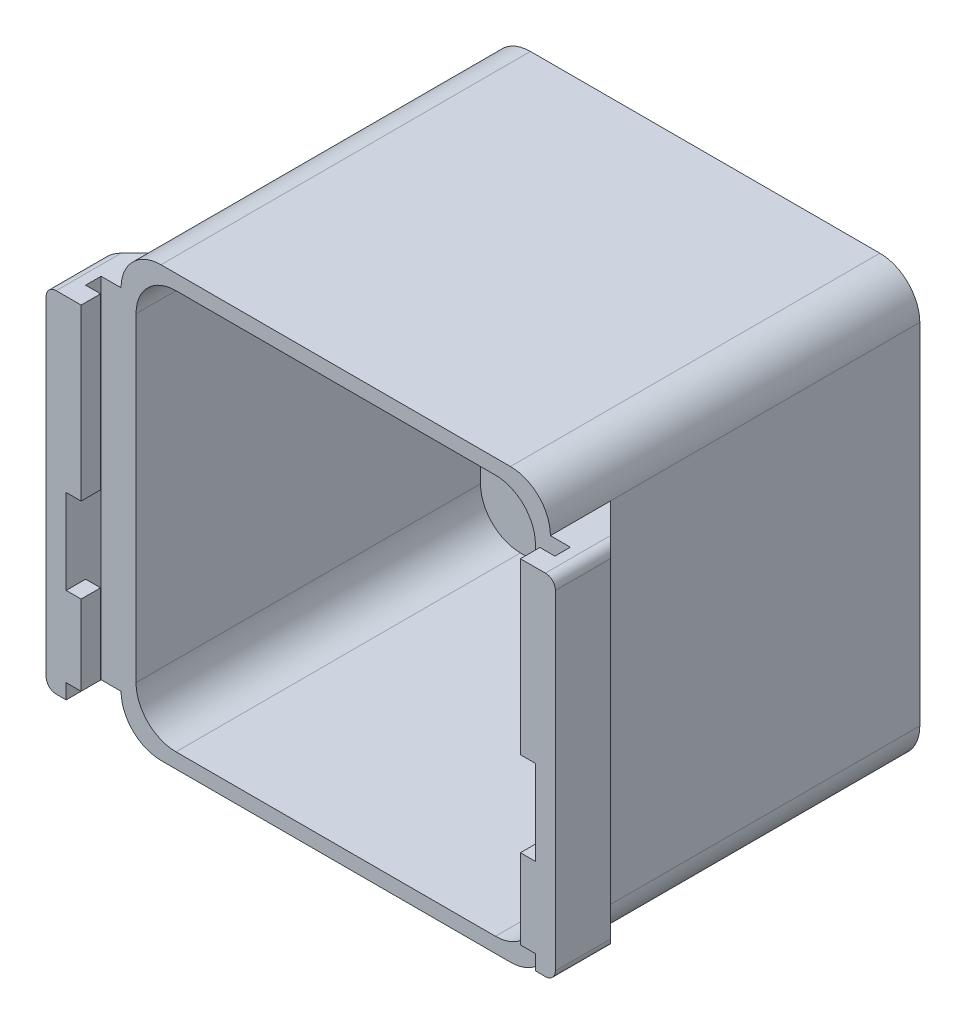
from build123d import *

# Parameters (mm, degrees)
SKETCH_1_W                  = 80
SKETCH_1_H                  = 80
EXTRUDE_1_DEPTH             = 70
SHELL_1_T                   = 3
SKETCH_2_W                  = 80
SKETCH_2_H                  = 80
SKETCH_2_W_2                = 42
SKETCH_2_H_2                = 42
EXTRUDE_2_DEPTH             = 1
FILLET_1_R                  = 8
SKETCH_3_W                  = 4
SKETCH_3_H                  = 70
EXTRUDE_3_DEPTH             = 8
SKETCH_4_W                  = 4
SKETCH_4_H                  = 70
EXTRUDE_4_DEPTH             = 7
SKETCH_5_W                  = 3.9
SKETCH_5_H                  = 67
EXTRUDE_5_DEPTH             = 3
SKETCH_8_W                  = 3.9
SKETCH_8_H                  = 17
CUT_EXTRUDE_2_DEPTH         = 3
FILLET_2_R                  = 2
CHAMFER_START               = -35
CHAMFER_1_DEPTH             = 70
CHAMFER_START_2             = 63
CHAMFER_1_2_DEPTH           = 3
EXTRUDE_START               = 1
EXTRUDE_6_DEPTH             = 1
SKETCH_7_R                  = 5.5
CUT_EXTRUDE_1_DEPTH         = 2
PATTERN_LINEAR_1_COUNT      = 3
PATTERN_LINEAR_1_PITCH      = 14
PATTERN_LINEAR_1_COUNT_DIR2 = 3
PATTERN_LINEAR_1_PITCH_DIR2 = 14
MIRROR_2_COPY_1_SKETCH_R    = 5.5
MIRROR_2_COPY_1_DEPTH       = 2
MIRROR_2_COPY_2_SKETCH_R    = 5.5
MIRROR_2_COPY_2_DEPTH       = 2
MIRROR_2_COPY_3_SKETCH_R    = 5.5
MIRROR_2_COPY_3_DEPTH       = 2
MIRROR_2_COPY_4_SKETCH_R    = 5.5
MIRROR_2_COPY_4_DEPTH       = 2
MIRROR_2_COPY_5_SKETCH_R    = 5.5
MIRROR_2_COPY_5_DEPTH       = 2
MIRROR_2_COPY_6_SKETCH_R    = 5.5
MIRROR_2_COPY_6_DEPTH       = 2
MIRROR_2_COPY_7_SKETCH_R    = 5.5
MIRROR_2_COPY_7_DEPTH       = 2
MIRROR_2_COPY_8_SKETCH_R    = 5.5
MIRROR_2_COPY_8_DEPTH       = 2
MIRROR_2_COPY_9_SKETCH_R    = 5.5
MIRROR_2_COPY_9_DEPTH       = 2
MIRROR_3_COPY_1_SKETCH_R    = 5.5
MIRROR_3_COPY_1_DEPTH       = 2
MIRROR_3_COPY_2_SKETCH_R    = 5.5
MIRROR_3_COPY_2_DEPTH       = 2
MIRROR_3_COPY_3_SKETCH_R    = 5.5
MIRROR_3_COPY_3_DEPTH       = 2
MIRROR_3_COPY_4_SKETCH_R    = 5.5
MIRROR_3_COPY_4_DEPTH       = 2
MIRROR_3_COPY_5_SKETCH_R    = 5.5
MIRROR_3_COPY_5_DEPTH       = 2
MIRROR_3_COPY_6_SKETCH_R    = 5.5
MIRROR_3_COPY_6_DEPTH       = 2
MIRROR_3_COPY_7_SKETCH_R    = 5.5
MIRROR_3_COPY_7_DEPTH       = 2
MIRROR_3_COPY_8_SKETCH_R    = 5.5
MIRROR_3_COPY_8_DEPTH       = 2
MIRROR_3_COPY_9_SKETCH_R    = 5.5
MIRROR_3_COPY_9_DEPTH       = 2
MIRROR_3_COPY_10_SKETCH_R   = 5.5
MIRROR_3_COPY_10_DEPTH      = 2
MIRROR_3_COPY_11_SKETCH_R   = 5.5
MIRROR_3_COPY_11_DEPTH      = 2
MIRROR_3_COPY_12_SKETCH_R   = 5.5
MIRROR_3_COPY_12_DEPTH      = 2
MIRROR_3_COPY_13_SKETCH_R   = 5.5
MIRROR_3_COPY_13_DEPTH      = 2
MIRROR_3_COPY_14_SKETCH_R   = 5.5
MIRROR_3_COPY_14_DEPTH      = 2
MIRROR_3_COPY_15_SKETCH_R   = 5.5
MIRROR_3_COPY_15_DEPTH      = 2
MIRROR_3_COPY_16_SKETCH_R   = 5.5
MIRROR_3_COPY_16_DEPTH      = 2
MIRROR_3_COPY_17_SKETCH_R   = 5.5
MIRROR_3_COPY_17_DEPTH      = 2
MIRROR_3_COPY_18_SKETCH_R   = 5.5
MIRROR_3_COPY_18_DEPTH      = 2
MIRROR_3_COPY_19_SKETCH_R   = 5.5
MIRROR_3_COPY_19_DEPTH      = 2


with BuildPart() as part:
    # 草图1 → 凸台-拉伸1 (new body)
    with BuildSketch(Plane.XY):
        Rectangle(SKETCH_1_W, SKETCH_1_H)
    extrude(amount=EXTRUDE_1_DEPTH)

    # 抽壳1
    shell_1_openings = [part.faces().sort_by_distance(p)[0] for p in [
        (0, 0, 70),
    ]]
    offset(amount=SHELL_1_T, openings=shell_1_openings, kind=Kind.INTERSECTION)

    # 草图2 → 凸台-拉伸2 (add)
    with BuildSketch(Plane.XY):
        Rectangle(SKETCH_2_W, SKETCH_2_H)
        Rectangle(SKETCH_2_W_2, SKETCH_2_H_2, mode=Mode.SUBTRACT)
    extrude(amount=EXTRUDE_2_DEPTH)

    # 圆角1
    fillet_1_edges = [part.edges().sort_by_distance(p)[0] for p in [
        (40, -40, 35.5),
        (40, 40, 35.5),
        (-40, 40, 35.5),
        (-40, -40, 35.5),
        (43, -43, 33.5),
        (-43, -43, 33.5),
        (-43, 43, 33.5),
        (43, 43, 33.5),
    ]]
    fillet(fillet_1_edges, radius=FILLET_1_R)

    # 草图3 → 凸台-拉伸3 (add)
    with BuildSketch(Plane.ZY.offset(43)):
        with Locations((68, 0)):
            Rectangle(SKETCH_3_W, SKETCH_3_H)
    extrude_3 = extrude(amount=EXTRUDE_3_DEPTH)

    # 草图4 → 凸台-拉伸4 (add)
    with BuildSketch(Plane.XY.offset(70)):
        with Locations((-49, 0)):
            Rectangle(SKETCH_4_W, SKETCH_4_H)
    extrude_4 = extrude(amount=EXTRUDE_4_DEPTH)

    # 草图5 → 凸台-拉伸5 (add)
    with BuildSketch(Plane(origin=(-47, 0, 0), x_dir=(0, 0, -1), z_dir=(1, 0, 0))):
        with Locations((-75.05, 1.5)):
            Rectangle(SKETCH_5_W, SKETCH_5_H)
    extrude_5 = extrude(amount=EXTRUDE_5_DEPTH)

    # 草图8 → 切除-拉伸2 (cut)
    with BuildSketch(Plane(origin=(-44, 0, 0), x_dir=(0, 0, -1), z_dir=(1, 0, 0))):
        with Locations((-75.05, -7.5)):
            Rectangle(SKETCH_8_W, SKETCH_8_H)
    cut_extrude_2 = extrude(amount=-CUT_EXTRUDE_2_DEPTH, mode=Mode.SUBTRACT)

    # 镜向1: 凸台-拉伸3, 凸台-拉伸4, 凸台-拉伸5, 切除-拉伸2 across plane
    add(extrude_3.mirror(Plane(origin=(0, 0, 0), x_dir=(0, 0, 1), z_dir=(1, 0, 0))))
    add(extrude_4.mirror(Plane(origin=(0, 0, 0), x_dir=(0, 0, 1), z_dir=(1, 0, 0))))
    add(extrude_5.mirror(Plane(origin=(0, 0, 0), x_dir=(0, 0, 1), z_dir=(1, 0, 0))))
    add(cut_extrude_2.mirror(Plane(origin=(0, 0, 0), x_dir=(0, 0, 1), z_dir=(1, 0, 0))), mode=Mode.SUBTRACT)

    # 圆角2
    fillet_2_edges = [part.edges().sort_by_distance(p)[0] for p in [
        (-51, -35, 71.5),
        (-51, 35, 71.5),
        (51, 35, 71.5),
        (51, -35, 71.5),
    ]]
    fillet(fillet_2_edges, radius=FILLET_2_R)

    # 倒角1: read off the stored shape, not the designer's step
    # 倒角1 outline → 倒角1 (add)
    with BuildSketch(Plane(origin=(0, 0, 0), x_dir=(1, 0, 0), z_dir=(0, 1, 0)).offset(CHAMFER_START)):
        Polygon((51, -66), (43, -58), (43, -66), align=None)
        Polygon((-43, -66), (-43, -58), (-51, -66), align=None)
    extrude(amount=CHAMFER_1_DEPTH)

    # Chamfer 1 2 outline → Chamfer 1 2 (cut)
    with BuildSketch(Plane.XY.offset(CHAMFER_START_2)):
        with BuildLine():
            Line((51.000000043, 35.000000063), (49, 35))
            ThreePointArc((49, 35), (50.414213562, 34.414213562), (51, 33))
            Line((51, 33), (51.000000043, 35.000000063))
        make_face()
        with BuildLine():
            ThreePointArc((-51, 33), (-50.414213562, 34.414213562), (-49, 35))
            Line((-49, 35), (-51.000000043, 35.000000063))
            Line((-51.000000043, 35.000000063), (-51, 33))
        make_face()
        with BuildLine():
            Line((51.000000043, -35.000000063), (51, -33))
            ThreePointArc((51, -33), (50.414213562, -34.414213562), (49, -35))
            Line((49, -35), (51.000000043, -35.000000063))
        make_face()
        with BuildLine():
            ThreePointArc((-49, -35), (-50.414213562, -34.414213562), (-51, -33))
            Line((-51, -33), (-51.000000043, -35.000000063))
            Line((-51.000000043, -35.000000063), (-49, -35))
        make_face()
    extrude(amount=CHAMFER_1_2_DEPTH, mode=Mode.SUBTRACT)

    # 草图6 → 凸台-拉伸6 (add)
    with BuildSketch(Plane(origin=(0, 0, -3), x_dir=(-1, 0, 0), z_dir=(0, 0, -1)).offset(EXTRUDE_START)):
        with BuildLine():
            Line((-43, 35), (-43, -35))
            ThreePointArc((-43, -35), (-40.656854249, -40.656854249), (-35, -43))
            Line((-35, -43), (35, -43))
            ThreePointArc((35, -43), (40.656854249, -40.656854249), (43, -35))
            Line((43, -35), (43, 35))
            ThreePointArc((43, 35), (40.656854249, 40.656854249), (35, 43))
            Line((35, 43), (-35, 43))
            ThreePointArc((-35, 43), (-40.656854249, 40.656854249), (-43, 35))
        make_face()
    extrude(amount=-EXTRUDE_6_DEPTH)

    # 草图7 → 切除-拉伸1 (cut)
    with BuildSketch(Plane(origin=(0, 0, -4), x_dir=(-1, 0, 0), z_dir=(0, 0, -1))):
        Circle(SKETCH_7_R)
    cut_extrude_1 = extrude(amount=-CUT_EXTRUDE_1_DEPTH, mode=Mode.SUBTRACT)

    # 阵列(线性)1: Cut-Extrude 1 3 × 3
    with Locations(*[(-i * PATTERN_LINEAR_1_PITCH, -j * PATTERN_LINEAR_1_PITCH_DIR2, 0) for i in range(PATTERN_LINEAR_1_COUNT) for j in range(PATTERN_LINEAR_1_COUNT_DIR2) if (i, j) != (0, 0)]):
        add(cut_extrude_1, mode=Mode.SUBTRACT)

    # 镜向2 copy 1 sketch → 镜向2 copy 1 (cut)
    with BuildSketch(Plane(origin=(0, 14, -4), x_dir=(-1, 0, 0), z_dir=(0, 0, -1))):
        Circle(MIRROR_2_COPY_1_SKETCH_R)
    extrude(amount=-MIRROR_2_COPY_1_DEPTH, mode=Mode.SUBTRACT)

    # 镜向2 copy 2 sketch → 镜向2 copy 2 (cut)
    with BuildSketch(Plane(origin=(0, 28, -4), x_dir=(-1, 0, 0), z_dir=(0, 0, -1))):
        Circle(MIRROR_2_COPY_2_SKETCH_R)
    extrude(amount=-MIRROR_2_COPY_2_DEPTH, mode=Mode.SUBTRACT)

    # 镜向2 copy 3 sketch → 镜向2 copy 3 (cut)
    with BuildSketch(Plane(origin=(-14, 0, -4), x_dir=(-1, 0, 0), z_dir=(0, 0, -1))):
        Circle(MIRROR_2_COPY_3_SKETCH_R)
    extrude(amount=-MIRROR_2_COPY_3_DEPTH, mode=Mode.SUBTRACT)

    # 镜向2 copy 4 sketch → 镜向2 copy 4 (cut)
    with BuildSketch(Plane(origin=(-14, 14, -4), x_dir=(-1, 0, 0), z_dir=(0, 0, -1))):
        Circle(MIRROR_2_COPY_4_SKETCH_R)
    extrude(amount=-MIRROR_2_COPY_4_DEPTH, mode=Mode.SUBTRACT)

    # 镜向2 copy 5 sketch → 镜向2 copy 5 (cut)
    with BuildSketch(Plane(origin=(-14, 28, -4), x_dir=(-1, 0, 0), z_dir=(0, 0, -1))):
        Circle(MIRROR_2_COPY_5_SKETCH_R)
    extrude(amount=-MIRROR_2_COPY_5_DEPTH, mode=Mode.SUBTRACT)

    # 镜向2 copy 6 sketch → 镜向2 copy 6 (cut)
    with BuildSketch(Plane(origin=(-28, 0, -4), x_dir=(-1, 0, 0), z_dir=(0, 0, -1))):
        Circle(MIRROR_2_COPY_6_SKETCH_R)
    extrude(amount=-MIRROR_2_COPY_6_DEPTH, mode=Mode.SUBTRACT)

    # 镜向2 copy 7 sketch → 镜向2 copy 7 (cut)
    with BuildSketch(Plane(origin=(-28, 14, -4), x_dir=(-1, 0, 0), z_dir=(0, 0, -1))):
        Circle(MIRROR_2_COPY_7_SKETCH_R)
    extrude(amount=-MIRROR_2_COPY_7_DEPTH, mode=Mode.SUBTRACT)

    # 镜向2 copy 8 sketch → 镜向2 copy 8 (cut)
    with BuildSketch(Plane(origin=(-28, 28, -4), x_dir=(-1, 0, 0), z_dir=(0, 0, -1))):
        Circle(MIRROR_2_COPY_8_SKETCH_R)
    extrude(amount=-MIRROR_2_COPY_8_DEPTH, mode=Mode.SUBTRACT)

    # 镜向2 copy 9 sketch → 镜向2 copy 9 (cut)
    with BuildSketch(Plane(origin=(0, 0, -4), x_dir=(-1, 0, 0), z_dir=(0, 0, -1))):
        Circle(MIRROR_2_COPY_9_SKETCH_R)
    extrude(amount=-MIRROR_2_COPY_9_DEPTH, mode=Mode.SUBTRACT)

    # 镜向3 copy 1 sketch → 镜向3 copy 1 (cut)
    with BuildSketch(Plane(origin=(0, -14, -4), x_dir=(1, 0, 0), z_dir=(0, 0, -1))):
        Circle(MIRROR_3_COPY_1_SKETCH_R)
    extrude(amount=-MIRROR_3_COPY_1_DEPTH, mode=Mode.SUBTRACT)

    # 镜向3 copy 2 sketch → 镜向3 copy 2 (cut)
    with BuildSketch(Plane(origin=(0, -28, -4), x_dir=(1, 0, 0), z_dir=(0, 0, -1))):
        Circle(MIRROR_3_COPY_2_SKETCH_R)
    extrude(amount=-MIRROR_3_COPY_2_DEPTH, mode=Mode.SUBTRACT)

    # 镜向3 copy 3 sketch → 镜向3 copy 3 (cut)
    with BuildSketch(Plane(origin=(14, 0, -4), x_dir=(1, 0, 0), z_dir=(0, 0, -1))):
        Circle(MIRROR_3_COPY_3_SKETCH_R)
    extrude(amount=-MIRROR_3_COPY_3_DEPTH, mode=Mode.SUBTRACT)

    # 镜向3 copy 4 sketch → 镜向3 copy 4 (cut)
    with BuildSketch(Plane(origin=(14, -14, -4), x_dir=(1, 0, 0), z_dir=(0, 0, -1))):
        Circle(MIRROR_3_COPY_4_SKETCH_R)
    extrude(amount=-MIRROR_3_COPY_4_DEPTH, mode=Mode.SUBTRACT)

    # 镜向3 copy 5 sketch → 镜向3 copy 5 (cut)
    with BuildSketch(Plane(origin=(14, -28, -4), x_dir=(1, 0, 0), z_dir=(0, 0, -1))):
        Circle(MIRROR_3_COPY_5_SKETCH_R)
    extrude(amount=-MIRROR_3_COPY_5_DEPTH, mode=Mode.SUBTRACT)

    # 镜向3 copy 6 sketch → 镜向3 copy 6 (cut)
    with BuildSketch(Plane(origin=(28, 0, -4), x_dir=(1, 0, 0), z_dir=(0, 0, -1))):
        Circle(MIRROR_3_COPY_6_SKETCH_R)
    extrude(amount=-MIRROR_3_COPY_6_DEPTH, mode=Mode.SUBTRACT)

    # 镜向3 copy 7 sketch → 镜向3 copy 7 (cut)
    with BuildSketch(Plane(origin=(28, -14, -4), x_dir=(1, 0, 0), z_dir=(0, 0, -1))):
        Circle(MIRROR_3_COPY_7_SKETCH_R)
    extrude(amount=-MIRROR_3_COPY_7_DEPTH, mode=Mode.SUBTRACT)

    # 镜向3 copy 8 sketch → 镜向3 copy 8 (cut)
    with BuildSketch(Plane(origin=(28, -28, -4), x_dir=(1, 0, 0), z_dir=(0, 0, -1))):
        Circle(MIRROR_3_COPY_8_SKETCH_R)
    extrude(amount=-MIRROR_3_COPY_8_DEPTH, mode=Mode.SUBTRACT)

    # 镜向3 copy 9 sketch → 镜向3 copy 9 (cut)
    with BuildSketch(Plane(origin=(0, 0, -4), x_dir=(1, 0, 0), z_dir=(0, 0, -1))):
        Circle(MIRROR_3_COPY_9_SKETCH_R)
    extrude(amount=-MIRROR_3_COPY_9_DEPTH, mode=Mode.SUBTRACT)

    # 镜向3 copy 10 sketch → 镜向3 copy 10 (cut)
    with BuildSketch(Plane(origin=(0, 14, -4), x_dir=(1, 0, 0), z_dir=(0, 0, -1))):
        Circle(MIRROR_3_COPY_10_SKETCH_R)
    extrude(amount=-MIRROR_3_COPY_10_DEPTH, mode=Mode.SUBTRACT)

    # 镜向3 copy 11 sketch → 镜向3 copy 11 (cut)
    with BuildSketch(Plane(origin=(0, 28, -4), x_dir=(1, 0, 0), z_dir=(0, 0, -1))):
        Circle(MIRROR_3_COPY_11_SKETCH_R)
    extrude(amount=-MIRROR_3_COPY_11_DEPTH, mode=Mode.SUBTRACT)

    # 镜向3 copy 12 sketch → 镜向3 copy 12 (cut)
    with BuildSketch(Plane(origin=(14, 0, -4), x_dir=(1, 0, 0), z_dir=(0, 0, -1))):
        Circle(MIRROR_3_COPY_12_SKETCH_R)
    extrude(amount=-MIRROR_3_COPY_12_DEPTH, mode=Mode.SUBTRACT)

    # 镜向3 copy 13 sketch → 镜向3 copy 13 (cut)
    with BuildSketch(Plane(origin=(14, 14, -4), x_dir=(1, 0, 0), z_dir=(0, 0, -1))):
        Circle(MIRROR_3_COPY_13_SKETCH_R)
    extrude(amount=-MIRROR_3_COPY_13_DEPTH, mode=Mode.SUBTRACT)

    # 镜向3 copy 14 sketch → 镜向3 copy 14 (cut)
    with BuildSketch(Plane(origin=(14, 28, -4), x_dir=(1, 0, 0), z_dir=(0, 0, -1))):
        Circle(MIRROR_3_COPY_14_SKETCH_R)
    extrude(amount=-MIRROR_3_COPY_14_DEPTH, mode=Mode.SUBTRACT)

    # 镜向3 copy 15 sketch → 镜向3 copy 15 (cut)
    with BuildSketch(Plane(origin=(28, 0, -4), x_dir=(1, 0, 0), z_dir=(0, 0, -1))):
        Circle(MIRROR_3_COPY_15_SKETCH_R)
    extrude(amount=-MIRROR_3_COPY_15_DEPTH, mode=Mode.SUBTRACT)

    # 镜向3 copy 16 sketch → 镜向3 copy 16 (cut)
    with BuildSketch(Plane(origin=(28, 14, -4), x_dir=(1, 0, 0), z_dir=(0, 0, -1))):
        Circle(MIRROR_3_COPY_16_SKETCH_R)
    extrude(amount=-MIRROR_3_COPY_16_DEPTH, mode=Mode.SUBTRACT)

    # 镜向3 copy 17 sketch → 镜向3 copy 17 (cut)
    with BuildSketch(Plane(origin=(28, 28, -4), x_dir=(1, 0, 0), z_dir=(0, 0, -1))):
        Circle(MIRROR_3_COPY_17_SKETCH_R)
    extrude(amount=-MIRROR_3_COPY_17_DEPTH, mode=Mode.SUBTRACT)

    # 镜向3 copy 18 sketch → 镜向3 copy 18 (cut)
    with BuildSketch(Plane(origin=(0, 0, -4), x_dir=(1, 0, 0), z_dir=(0, 0, -1))):
        Circle(MIRROR_3_COPY_18_SKETCH_R)
    extrude(amount=-MIRROR_3_COPY_18_DEPTH, mode=Mode.SUBTRACT)

    # 镜向3 copy 19 sketch → 镜向3 copy 19 (cut)
    with BuildSketch(Plane(origin=(0, 0, -4), x_dir=(1, 0, 0), z_dir=(0, 0, -1))):
        Circle(MIRROR_3_COPY_19_SKETCH_R)
    extrude(amount=-MIRROR_3_COPY_19_DEPTH, mode=Mode.SUBTRACT)


solid = part.part
